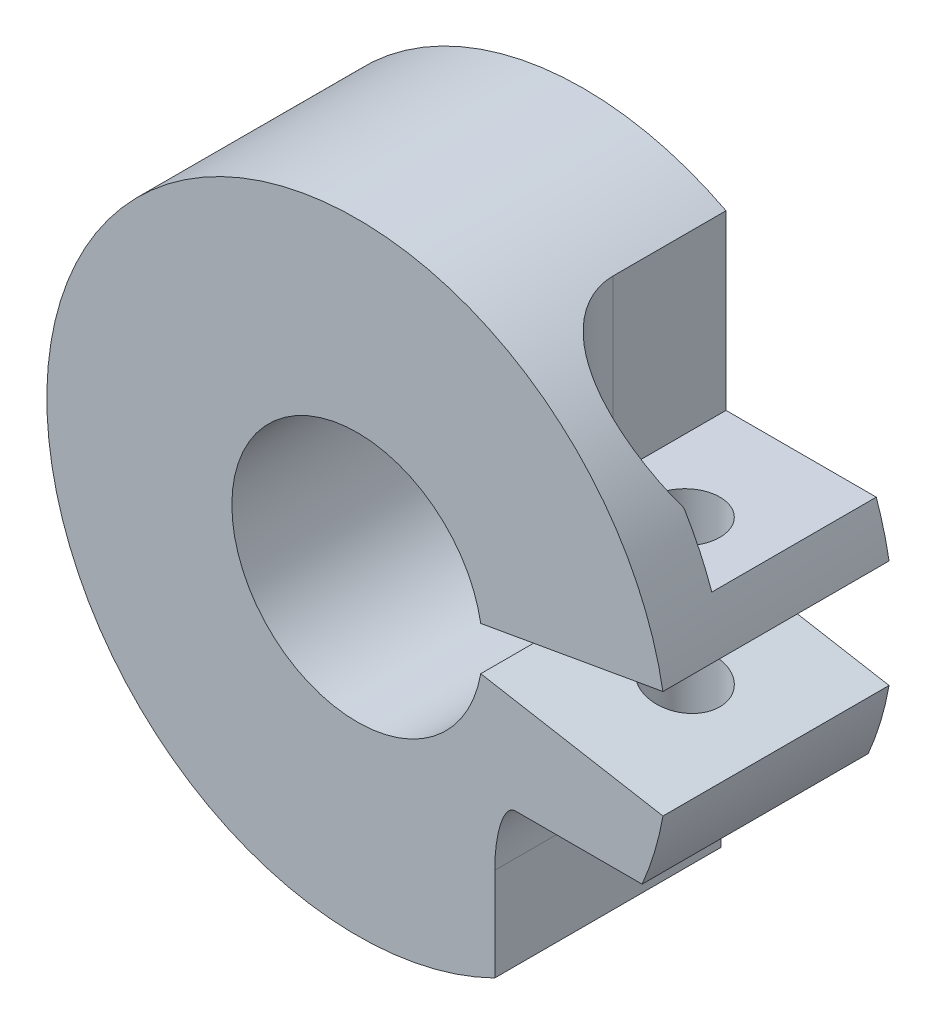
from build123d import *

# Parameters (mm, degrees)
BOSS_EXTRUDE1_DEPTH     = 11
CUT_EXTRUDE1_DEPTH      = 25.021240601
CUT_EXTRUDE1_DEPTH_BACK = 25.021240601
SKETCH3_R               = 1.7
CUT_EXTRUDE2_START      = 5
SKETCH3_3_R             = 3.5
SKETCH3_3_R_2           = 1.7
CUT_EXTRUDE2_DEPTH      = 20.021240772
CUT_EXTRUDE4_START      = -6
SKETCH4_W               = 8.181634888
SKETCH4_H               = 11
CUT_EXTRUDE4_DEPTH      = 19.021240772
FILLET1_SIZE            = 1
FILLET1_SIZE_2          = 3


with BuildPart() as part:
    # Sketch1 → Boss-Extrude1 (new body)
    with BuildSketch(Plane.XY):
        with BuildLine():
            Line((6.007327293, 1.059253884), (14.87059707, 2.622087483))
            ThreePointArc((14.87059707, 2.622087483), (-15.1, 0), (14.87059707, -2.622087483))
            Line((14.87059707, -2.622087483), (6.007327293, -1.059253884))
            ThreePointArc((6.007327293, -1.059253884), (-6.1, 0), (6.007327293, 1.059253884))
        make_face()
    extrude(amount=BOSS_EXTRUDE1_DEPTH)

    # Sketch3 → Cut-Extrude1 (cut, two sides: drawn at the far end of the back side and taken through both)
    with BuildSketch(Plane(origin=(0, 0, 0), x_dir=(1, 0, 0), z_dir=(0, 1, 0)).offset(-CUT_EXTRUDE1_DEPTH_BACK)):
        with Locations(Location((10.438962182, -5.5, 0), (0, 0, 270))):
            Circle(SKETCH3_R)
    extrude(amount=CUT_EXTRUDE1_DEPTH + CUT_EXTRUDE1_DEPTH_BACK, mode=Mode.SUBTRACT)

    # Sketch3<3> → Cut-Extrude2 (cut, through all)
    # profile 1 of 2: a face of its own
    with BuildSketch(Plane(origin=(0, 0, 0), x_dir=(1, 0, 0), z_dir=(0, 1, 0)).offset(CUT_EXTRUDE2_START)):
        with Locations((10.438962182, -5.5)):
            Circle(SKETCH3_3_R)
        with Locations(Location((10.438962182, -5.5, 0), (0, 0, 270))):
            Circle(SKETCH3_3_R_2, mode=Mode.SUBTRACT)
    # profile 2 of 2: a face of its own
    with BuildSketch(Plane(origin=(0, 0, 0), x_dir=(1, 0, 0), z_dir=(0, 1, 0)).offset(CUT_EXTRUDE2_START)):
        with BuildLine():
            Line((6.938962182, 0), (6.938962182, -5.5))
            ThreePointArc((6.938962182, -5.5), (10.438962182, -2), (13.938962182, -5.5))
            ThreePointArc((13.938962182, -5.5), (13.665664376, -6.855873501), (12.888451925, -8))
            Line((12.888451925, -8), (14.87059707, -8))
            Line((14.87059707, -8), (14.87059707, -5.5))
            Line((14.87059707, -5.5), (14.87059707, 0))
            Line((14.87059707, 0), (6.938962182, 0))
        make_face()
    extrude(amount=CUT_EXTRUDE2_DEPTH, mode=Mode.SUBTRACT)

    # Sketch4 → Cut-Extrude4 (cut, through all)
    with BuildSketch(Plane(origin=(0, 0, 0), x_dir=(1, 0, 0), z_dir=(0, 1, 0)).offset(CUT_EXTRUDE4_START)):
        with Locations((10.779779626, -5.5)):
            Rectangle(SKETCH4_W, SKETCH4_H)
    extrude(amount=-CUT_EXTRUDE4_DEPTH, mode=Mode.SUBTRACT)

    # Fillet1
    # an asymmetric fillet: 3, 1 mm, written as the material it adds along each edge
    with BuildSketch(Plane(origin=(6.688962182, -6, 0), x_dir=(1, 0, 0), z_dir=(0, 0, 1))) as fillet1_piece_1:
        with BuildLine():
            Bezier((FILLET1_SIZE, 0), (0, 0), (0, -FILLET1_SIZE_2), weights=[1, 0.707106781, 1])
            Line((0, -FILLET1_SIZE_2), (0, 0))
            Line((0, 0), (FILLET1_SIZE, 0))
        make_face()
    extrude(amount=11)


solid = part.part
